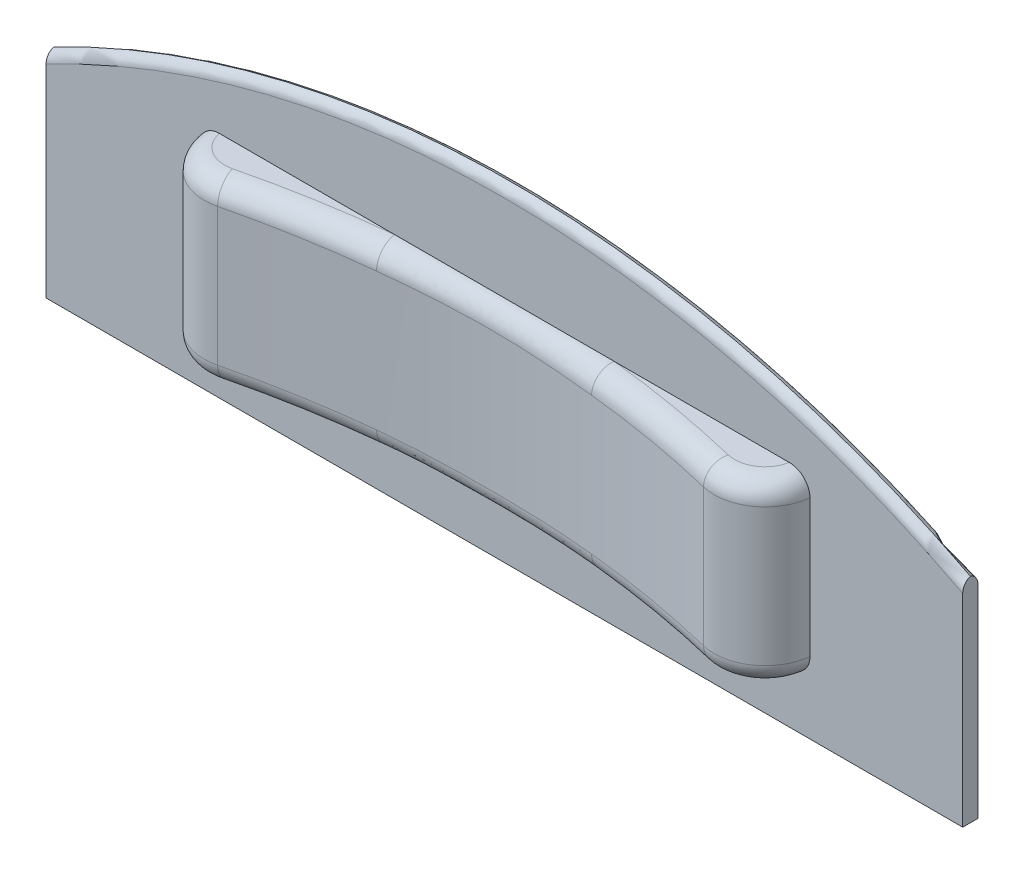
from build123d import *

# Parameters (mm, degrees)
BOSS_EXTRUDE1_DEPTH = 3
SKETCH2_W           = 120
SKETCH2_H           = 35
BOSS_EXTRUDE2_DEPTH = 12
CUT_EXTRUDE1_REACH  = 188.145
FILLET1_R           = 10
FILLET2_R           = 4
FILLET3_R           = 2


with BuildPart() as part:
    # Sketch1 → Boss-Extrude1 (new body)
    with BuildSketch(Plane.XY):
        with BuildLine():
            Line((180, 0), (180, -42))
            Line((180, -42), (0, -42))
            Line((0, -42), (0, 0))
            ThreePointArc((0, 0), (90, 22), (180, 0))
        make_face()
    extrude(amount=BOSS_EXTRUDE1_DEPTH)

    # Sketch2 → Boss-Extrude2 (add)
    with BuildSketch(Plane.XY.offset(3)):
        with Locations((90, -14.5)):
            Rectangle(SKETCH2_W, SKETCH2_H)
    extrude(amount=BOSS_EXTRUDE2_DEPTH)

    # Sketch3 → Cut-Extrude1 (cut, up to next)
    with BuildSketch(Plane(origin=(0, 3, 0), x_dir=(1, 0, 0), z_dir=(0, 1, 0)), mode=Mode.PRIVATE) as cut_extrude1_sk1:
        with BuildLine():
            Line((30, -15), (150, -15))
            ThreePointArc((150, -15), (90, -5.870751133), (30, -15))
        make_face()
    cut_extrude1_tool1 = extrude(cut_extrude1_sk1.sketch, amount=-CUT_EXTRUDE1_REACH, mode=Mode.PRIVATE) & part.part
    add(cut_extrude1_tool1.solids().sort_by_distance((90, 3, 11.341124))[0], mode=Mode.SUBTRACT)

    # Fillet1
    # the kernel refuses this fillet: 10 mm, written as the material it takes off along each edge
    with BuildSketch(Plane(origin=(150, 34.911423728, 15), x_dir=(0, 0, -1), z_dir=(0, -1, 0)), Plane(origin=(30, -63.911423728, 15), x_dir=(0, 0, -1), z_dir=(0, 1, 0))) as fillet1_piece_1:
        with BuildLine():
            CenterArc((13.125456564, -9.936465545), FILLET1_R, 96.462082414, 97.214818073)
            Line((3.409011311, -12.300929891), (3.214682406, -12.348219178))
            ThreePointArc((3.214682406, -12.348219178), (1.609086457, -6.176908891), (-0.190949181, -0.059484539))
            Line((-0.190949181, -0.059484539), (0, 0.2))
            ThreePointArc((0, 0.2), (6, 0.2), (11.977490869, 0.198729311))
            Line((11.977490869, 0.198729311), (12, 0))
        make_face()
    extrude(amount=98.822847456, mode=Mode.SUBTRACT)

    # Fillet2
    fillet2_edges = [part.edges().sort_by_distance(p)[0] for p in [
        (90, -32, 5.870751133),
        (90, 3, 5.870751133),
        (34.210640521, 3, 10.073014501),
        (145.789359479, 3, 10.073014501),
        (34.210640521, -32, 10.073014501),
        (145.789359479, -32, 10.073014501),
    ]]
    fillet(fillet2_edges, radius=FILLET2_R)

    # Fillet3
    # the kernel refuses this fillet: 2 mm, written as the material it takes off along each edge
    with BuildSketch(Plane(origin=(90, -173.090909091, 0), x_dir=(-0.4839116978541771, 0.8751168314458863, 0), z_dir=(-0.8751168314458863, -0.4839116978541771, 0))) as fillet3_piece_1:
        with BuildLine():
            CenterArc((195.090909091 - FILLET3_R, -FILLET3_R), FILLET3_R, 0, 90)
            Line((195.090909091 - FILLET3_R, 0), (195.090909091, 0))
            Line((195.090909091, 0), (195.090909091, -FILLET3_R))
        make_face()
    revolve(axis=Axis((90, -173.090909091, 0), (0, 0, -1)), revolution_arc=57.882388788, mode=Mode.SUBTRACT)
    with BuildSketch(Plane(origin=(90, -173.090909091, 3), x_dir=(-0.4839116978541771, 0.8751168314458863, 0), z_dir=(-0.8751168314458863, -0.4839116978541771, 0))) as fillet3_piece_2:
        with BuildLine():
            CenterArc((195.090909091 - FILLET3_R, FILLET3_R), FILLET3_R, 270, 90)
            Line((195.090909091, FILLET3_R), (195.090909091, 0))
            Line((195.090909091, 0), (195.090909091 - FILLET3_R, 0))
        make_face()
    revolve(axis=Axis((90, -173.090909091, 3), (0, 0, -1)), revolution_arc=57.882388788, mode=Mode.SUBTRACT)


solid = part.part
